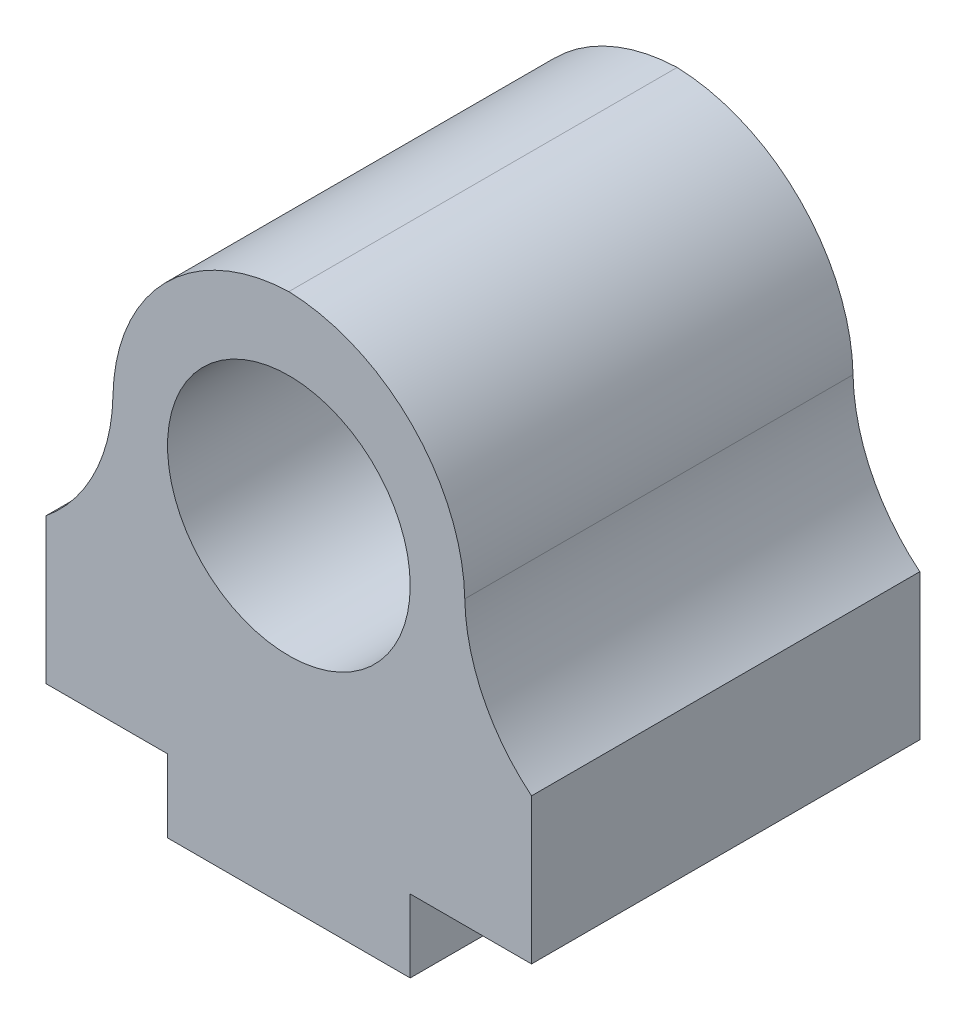
from build123d import *

# Parameters (mm, degrees)
SKETCH6_W           = 20
SKETCH6_H           = 16
BOSS_EXTRUDE5_DEPTH = 6
SKETCH7_W           = 10
SKETCH7_H           = 16
BOSS_EXTRUDE6_DEPTH = 3
SKETCH8_W           = 14.5
SKETCH8_H           = 16
BOSS_EXTRUDE7_DEPTH = 13
SKETCH9_R           = 5
CUT_EXTRUDE1_DEPTH  = 32.890437438
FILLET1_R           = 7.5
FILLET2_R           = 7.5


with BuildPart() as part:
    # Sketch6 → Boss-Extrude5 (new body)
    with BuildSketch(Plane(origin=(0, 0, 0), x_dir=(1, 0, 0), z_dir=(0, 1, 0))):
        with Locations((10, 8)):
            Rectangle(SKETCH6_W, SKETCH6_H)
    extrude(amount=BOSS_EXTRUDE5_DEPTH)

    # Sketch7 → Boss-Extrude6 (add)
    with BuildSketch(Plane.XZ):
        with Locations((10, -8)):
            Rectangle(SKETCH7_W, SKETCH7_H)
    extrude(amount=BOSS_EXTRUDE6_DEPTH)

    # Sketch8 → Boss-Extrude7 (add)
    with BuildSketch(Plane(origin=(0, 6, 0), x_dir=(1, 0, 0), z_dir=(0, 1, 0))):
        with Locations((10, 8)):
            Rectangle(SKETCH8_W, SKETCH8_H)
    extrude(amount=BOSS_EXTRUDE7_DEPTH)

    # Sketch9 → Cut-Extrude1 (cut, through all)
    with BuildSketch(Plane.XY):
        with Locations((10, 11)):
            Circle(SKETCH9_R)
    extrude(amount=-CUT_EXTRUDE1_DEPTH, mode=Mode.SUBTRACT)

    # Fillet1
    # the kernel refuses this fillet: 7.5 mm, written as the material it takes off along each edge
    with BuildSketch(Plane(origin=(17.25, 19, -34.75), x_dir=(-1, 0, 0), z_dir=(0, 0, 1))) as fillet1_piece_1:
        with BuildLine():
            CenterArc((FILLET1_R, FILLET1_R), FILLET1_R, 180, 90)
            Line((0, FILLET1_R), (0, 0))
            Line((0, 0), (FILLET1_R, 0))
        make_face()
    extrude(amount=53.5, mode=Mode.SUBTRACT)
    with BuildSketch(Plane(origin=(2.75, 19, 18.75), x_dir=(0, -1, 0), z_dir=(0, 0, -1))) as fillet1_piece_2:
        with BuildLine():
            CenterArc((FILLET1_R, -FILLET1_R), FILLET1_R, 90, 90)
            Line((0, -FILLET1_R), (0, 0))
            Line((0, 0), (FILLET1_R, 0))
        make_face()
    extrude(amount=53.5, mode=Mode.SUBTRACT)

    # Fillet2
    # the kernel refuses this fillet: 7.5 mm, written as the material it adds along each edge
    with BuildSketch(Plane(origin=(17.25, 6, -16), x_dir=(1, 0, 0), z_dir=(0, 0, 1))) as fillet2_piece_1:
        with BuildLine():
            CenterArc((7.496865043, 5.806657581), FILLET2_R, 181.171427285, 49.563032728)
            Line((-0.001567478, 5.65332879), (-0.75141073, 5.637995911))
            ThreePointArc((-0.75141073, 5.637995911), (-0.75, 5.5), (-0.75, 0))
            Line((-0.75, 0), (0, -0.75))
            ThreePointArc((0, -0.75), (1.375, -0.75), (2.275313496, -0.580665758))
            Line((2.275313496, -0.580665758), (2.75, 0))
        make_face()
    extrude(amount=16)
    with BuildSketch(Plane(origin=(2.75, 6, 0), x_dir=(0.00027726642617420565, 0.9999999615616638, 0), z_dir=(0, 0, -1))) as fillet2_piece_2:
        with BuildLine():
            CenterArc((5.804578729, -7.498474746), FILLET2_R, 91.155541089, 49.563032728)
            Line((-0.000762483, -2.749999894), (-0.581296604, -2.275152409))
            ThreePointArc((-0.581296604, -2.275152409), (-0.750381213, -1.374791997), (-0.749999971, 0.00020795))
            Line((-0.749999971, 0.00020795), (0.00020795, 0.749999971))
            ThreePointArc((0.00020795, 0.749999971), (5.500207738, 0.748475006), (5.638204036, 0.749847475))
            Line((5.638204036, 0.749847475), (5.653329008, 0))
        make_face()
    extrude(amount=16)


solid = part.part
